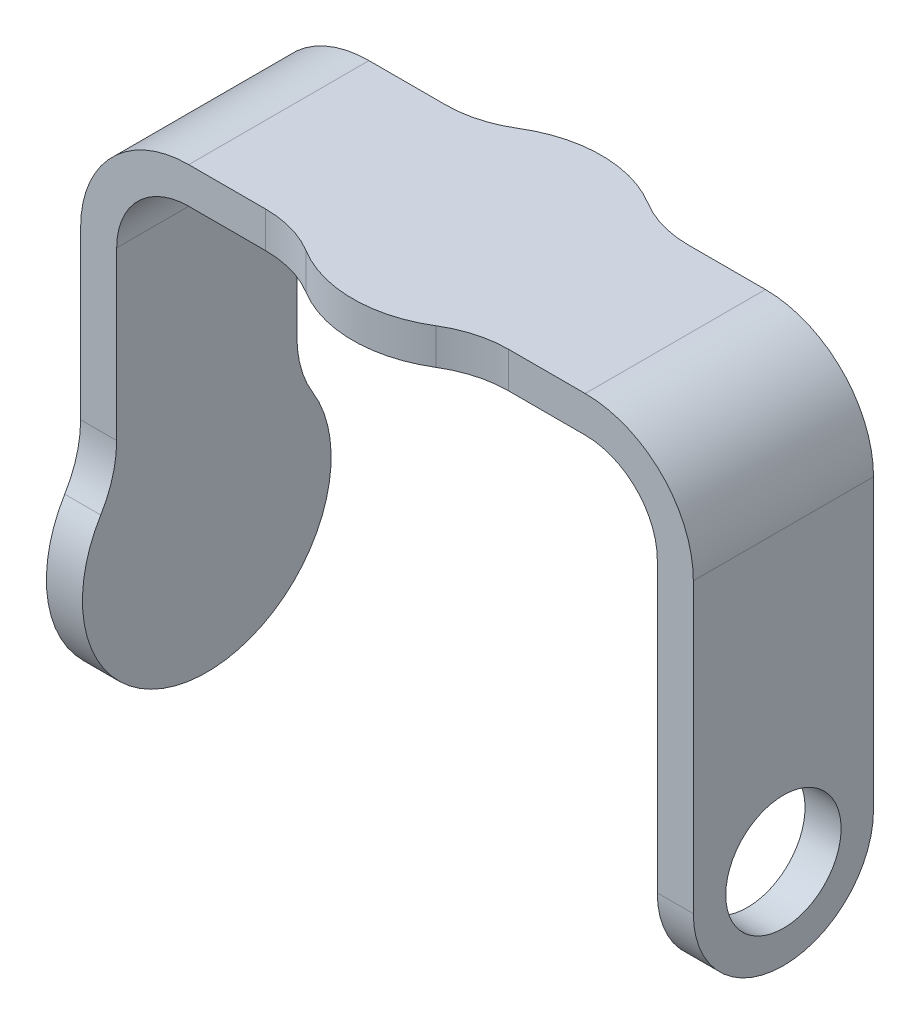
from build123d import *

# Parameters (mm, degrees)
BRACKET_U_SHAPE_DEPTH              = 12.5
SKETCH3_R                          = 17.25
MOTOR_RING_DEPTH                   = 5
MOTOR_RING_FILLETS_15MM_R          = 15
U_BRACKET_BOTTOM_ROUNDING_12_5MM_R = 12.5
SKETCH4_R                          = 17.25
TILT_MOTOR_TAB_DEPTH               = 5
TILT_MOTOR_TAB_FILLETS_15MM_R      = 15
SKETCH6_R                          = 8
BEARING_HOLE_CUT_DEPTH             = 106.925091456


with BuildPart() as part:
    # Sketch2 → Bracket U-shape (new, symmetric)
    with BuildSketch(Plane.XY):
        with BuildLine():
            Line((-37.5, -67.25), (-37.5, -10))
            ThreePointArc((-37.5, -10), (-34.571067812, -2.928932188), (-27.5, 0))
            Line((-27.5, 0), (27.5, 0))
            ThreePointArc((27.5, 0), (34.571067812, -2.928932188), (37.5, -10))
            Line((37.5, -10), (37.5, -67.25))
            Line((37.5, -67.25), (42.5, -67.25))
            Line((42.5, -67.25), (42.5, -10))
            ThreePointArc((42.5, -10), (38.106601718, 0.606601718), (27.5, 5))
            Line((27.5, 5), (-27.5, 5))
            ThreePointArc((-27.5, 5), (-38.106601718, 0.606601718), (-42.5, -10))
            Line((-42.5, -10), (-42.5, -67.25))
            Line((-42.5, -67.25), (-37.5, -67.25))
        make_face()
    extrude(amount=BRACKET_U_SHAPE_DEPTH, both=True)

    # Sketch3 → Motor ring (add)
    with BuildSketch(Plane(origin=(0, 5, 0), x_dir=(1, 0, 0), z_dir=(0, 1, 0))):
        Circle(SKETCH3_R)
    extrude(amount=-MOTOR_RING_DEPTH)

    # Motor ring fillets 15mm
    motor_ring_fillets_15mm_edges = [part.edges().sort_by_distance(p)[0] for p in [
        (11.887493428, 2.5, -12.5),
        (-11.887493428, 2.5, -12.5),
        (-11.887493428, 2.5, 12.5),
        (11.887493428, 2.5, 12.5),
    ]]
    fillet(motor_ring_fillets_15mm_edges, radius=MOTOR_RING_FILLETS_15MM_R)

    # U bracket bottom rounding 12.5mm
    u_bracket_bottom_rounding_12_5mm_edges = [part.edges().sort_by_distance(p)[0] for p in [
        (40, -67.25, 12.5),
        (40, -67.25, -12.5),
        (-40, -67.25, -12.5),
        (-40, -67.25, 12.5),
    ]]
    fillet(u_bracket_bottom_rounding_12_5mm_edges, radius=U_BRACKET_BOTTOM_ROUNDING_12_5MM_R - 0.0001)  # a hair under: the kernel refuses the full size

    # Sketch4 → Tilt motor tab (add)
    with BuildSketch(Plane.ZY.offset(42.5)):
        with Locations((0, -50)):
            Circle(SKETCH4_R)
    extrude(amount=-TILT_MOTOR_TAB_DEPTH)

    # Tilt motor tab fillets 15mm
    tilt_motor_tab_fillets_15mm_edges = [part.edges().sort_by_distance(p)[0] for p in [
        (-40, -38.112506572, 12.5),
        (-40, -38.112506572, -12.5),
    ]]
    fillet(tilt_motor_tab_fillets_15mm_edges, radius=TILT_MOTOR_TAB_FILLETS_15MM_R)

    # Sketch6 → Bearing hole cut (cut, through all)
    with BuildSketch(Plane.ZY.offset(-37.5)):
        with Locations((0, -50)):
            Circle(SKETCH6_R)
        with BuildLine():
            Line((12.5, -54.75), (12.5, -50))
            ThreePointArc((12.5, -50), (0, -62.5), (-12.5, -50))
            Line((-12.5, -50), (-12.5, -54.75))
            ThreePointArc((-12.5, -54.75), (-8.838834765, -63.588834765), (0, -67.25))
            ThreePointArc((0, -67.25), (8.838834765, -63.588834765), (12.5, -54.75))
        make_face()
    extrude(amount=-BEARING_HOLE_CUT_DEPTH, mode=Mode.SUBTRACT)


with BuildPart() as bearing_hole_cut_kept_piece:
    # of the separate pieces the step leaves, the one the design keeps (bearing_hole_cut_pieces_kept)
    add(part.part.solids().sort_by_distance((-37.5, -33.153264411, -12.5))[0])


solid = bearing_hole_cut_kept_piece.part
